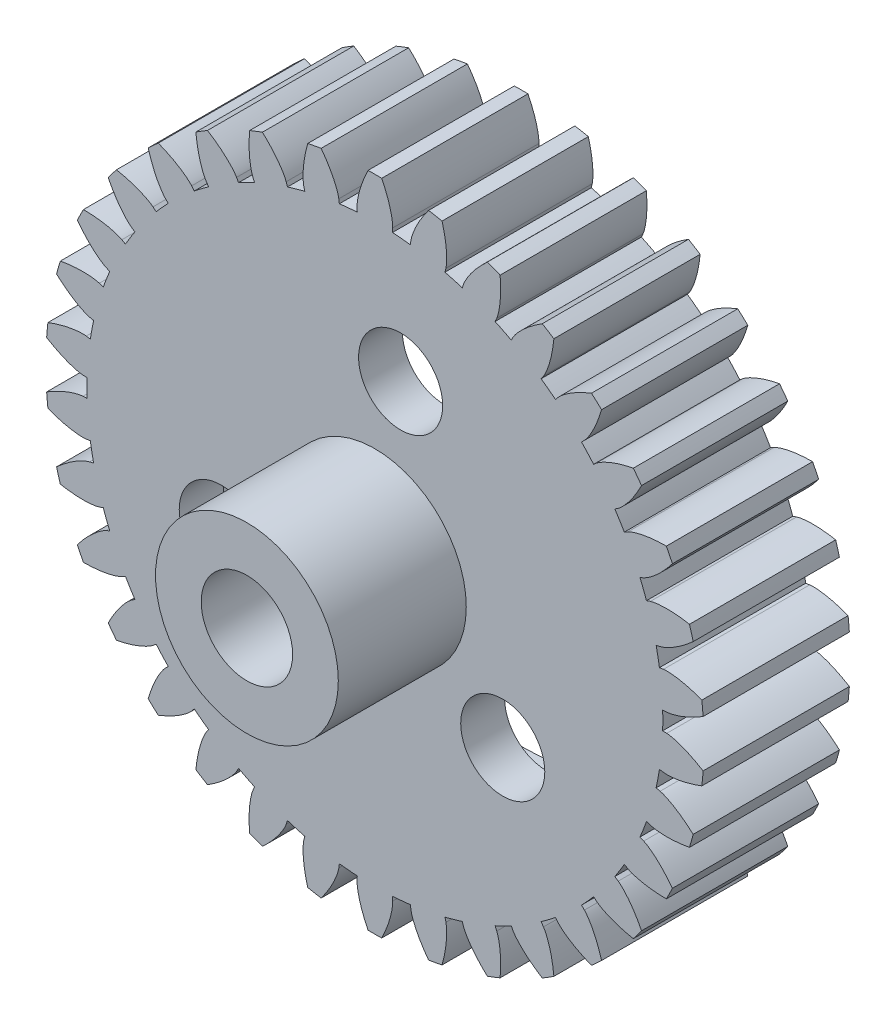
from build123d import *

# Parameters (mm, degrees)
SZKIC1_R                    = 18
DODANIE_WYCI_GNI_CIE1_DEPTH = 8
SZKIC2_R                    = 5
DODANIE_WYCI_GNI_CIE2_DEPTH = 7
SZKIC3_R                    = 2.5
WYTNIJ_WYCI_GNI_CIE1_DEPTH  = 30.546573405
WYTNIJ_WYCI_GNI_CIE3_DEPTH  = 30.546573405
SZYK_KO_OWY2_COUNT          = 34
SZKIC5_R                    = 2.3
WYTNIJ_WYCI_GNI_CIE4_DEPTH  = 30.518484561
SZKIC6_R                    = 13.1
WYTNIJ_WYCI_GNI_CIE5_DEPTH  = 5.6


with BuildPart() as part:
    # Szkic1 → Dodanie-wyciągnięcie1 (new body)
    with BuildSketch(Plane.XY):
        Circle(SZKIC1_R)
    extrude(amount=DODANIE_WYCI_GNI_CIE1_DEPTH)

    # Szkic2 → Dodanie-wyciągnięcie2 (add)
    with BuildSketch(Plane.XY.offset(8)):
        Circle(SZKIC2_R)
    extrude(amount=DODANIE_WYCI_GNI_CIE2_DEPTH)

    # Szkic3 → Wytnij-wyciągnięcie1 (cut, through all)
    with BuildSketch(Plane.XY.offset(15)):
        Circle(SZKIC3_R)
    extrude(amount=-WYTNIJ_WYCI_GNI_CIE1_DEPTH, mode=Mode.SUBTRACT)

    # Szkic4 → Wytnij-wyciągnięcie3 (cut, through all)
    with BuildSketch(Plane(origin=(0, 0, 0), x_dir=(-1, 0, 0), z_dir=(0, 0, -1))):
        with BuildLine():
            add(Edge.make_bspline(
                [(15.966952274, 0.499857083), (15.973588962, 0.500170319), (15.992186505, 0.50137492), (16.02727088, 0.504939353), (16.084356841, 0.51257942), (16.156811425, 0.524989314), (16.250055561, 0.544090693), (16.35930311, 0.570516104), (16.478642956, 0.603649308), (16.607603741, 0.644089594), (16.735410352, 0.688300579), (16.862041069, 0.735980193), (16.98736125, 0.78669031), (17.138115077, 0.851887366), (17.31737635, 0.935292978), (17.524511841, 1.040318379), (17.71815035, 1.147138444), (17.855509236, 1.228083556), (17.933604649, 1.275621993), (17.953855397, 1.288051396)],
                knots=[0, 0, 0, 0, 0, 0.005376749, 0.015083688, 0.02853182, 0.046610139, 0.064854849, 0.092110525, 0.119476176, 0.146842496, 0.174208854, 0.201574956, 0.228941013, 0.256307345, 0.307035032, 0.361767352, 0.416499661, 0.435734814, 0.435734814, 0.435734814, 0.435734814, 0.435734814], degree=4))
            Line((15.966952274, 0.499857083), (15.742287785, 0.492823797))
            ThreePointArc((15.742287785, 0.492823797), (15.75, 0), (15.742287785, -0.492823797))
            Line((15.742287785, -0.492823797), (15.966952274, -0.499857083))
            add(Edge.make_bspline(
                [(15.966952274, -0.499857083), (15.973588962, -0.500170319), (15.992186505, -0.50137492), (16.02727088, -0.504939353), (16.084356841, -0.51257942), (16.156811425, -0.524989314), (16.250055561, -0.544090693), (16.35930311, -0.570516104), (16.478642956, -0.603649308), (16.607603741, -0.644089594), (16.735410352, -0.688300579), (16.862041069, -0.735980193), (16.98736125, -0.78669031), (17.138115077, -0.851887366), (17.31737635, -0.935292978), (17.524511841, -1.040318379), (17.71815035, -1.147138444), (17.855509236, -1.228083556), (17.933604649, -1.275621993), (17.953855397, -1.288051396)],
                knots=[0, 0, 0, 0, 0, 0.005376749, 0.015083688, 0.02853182, 0.046610139, 0.064854849, 0.092110525, 0.119476176, 0.146842496, 0.174208854, 0.201574956, 0.228941013, 0.256307345, 0.307035032, 0.361767352, 0.416499661, 0.435734814, 0.435734814, 0.435734814, 0.435734814, 0.435734814], degree=4))
            ThreePointArc((17.953855397, -1.288051396), (18, 0), (17.953855397, 1.288051396))
        make_face()
        with BuildLine():
            ThreePointArc((17.411478068, -4.565132145), (17.693515794, -3.307491321), (17.884835713, -2.032892399))
            add(Edge.make_bspline(
                [(15.786933067, -2.442573715), (15.79351431, -2.443485301), (15.812016539, -2.4457185), (15.847158499, -2.448661495), (15.904676322, -2.451641033), (15.978177541, -2.452755935), (16.073343888, -2.451113359), (16.185586946, -2.445212075), (16.308983015, -2.434571666), (16.44317888, -2.418516435), (16.576933087, -2.398542629), (16.710168782, -2.374943184), (16.842673108, -2.348124026), (17.002839993, -2.311738017), (17.194374743, -2.262691716), (17.417281726, -2.197515619), (17.627251306, -2.128095352), (17.777145022, -2.073768113), (17.862645876, -2.041389102), (17.884835713, -2.032892399)],
                knots=[0, 0, 0, 0, 0, 0.005376749, 0.015083688, 0.02853182, 0.046610139, 0.064854849, 0.092110525, 0.119476176, 0.146842496, 0.174208854, 0.201574956, 0.228941013, 0.256307345, 0.307035032, 0.361767352, 0.416499661, 0.435734814, 0.435734814, 0.435734814, 0.435734814, 0.435734814], degree=4))
            Line((15.786933067, -2.442573715), (15.564801555, -2.408205254))
            ThreePointArc((15.564801555, -2.408205254), (15.48182632, -2.894054906), (15.383689285, -3.377070325))
            Line((15.383689285, -3.377070325), (15.603236072, -3.425265848))
            add(Edge.make_bspline(
                [(15.603236072, -3.425265848), (15.6097022, -3.426793239), (15.62776174, -3.431394618), (15.661593774, -3.441345097), (15.716303879, -3.459344595), (15.785244474, -3.484856683), (15.873391083, -3.520766389), (15.975922828, -3.566816041), (16.087142476, -3.621313729), (16.206476576, -3.684761925), (16.323983288, -3.751704536), (16.439696771, -3.821840647), (16.553565178, -3.894714851), (16.689772207, -3.986502747), (16.850655475, -4.101427392), (17.034965725, -4.242725582), (17.205679034, -4.383307815), (17.325825499, -4.488114312), (17.393856024, -4.549193312), (17.411478068, -4.565132145)],
                knots=[0, 0, 0, 0, 0, 0.005376749, 0.015083688, 0.02853182, 0.046610139, 0.064854849, 0.092110525, 0.119476176, 0.146842496, 0.174208854, 0.201574956, 0.228941013, 0.256307345, 0.307035032, 0.361767352, 0.416499661, 0.435734814, 0.435734814, 0.435734814, 0.435734814, 0.435734814], degree=4))
        make_face()
    wytnij_wyci_gni_cie3 = extrude(amount=-WYTNIJ_WYCI_GNI_CIE3_DEPTH, mode=Mode.SUBTRACT)

    # Szyk kołowy2: Wytnij-wyciągnięcie3 ×34 about axis
    szyk_ko_owy2_axis = Axis((0, 0, 0), (0, 0, 1))
    for i in range(1, SZYK_KO_OWY2_COUNT):
        add(wytnij_wyci_gni_cie3.rotate(szyk_ko_owy2_axis, i * 360 / SZYK_KO_OWY2_COUNT), mode=Mode.SUBTRACT)

    # Szkic5 → Wytnij-wyciągnięcie4 (cut, through all)
    with BuildSketch(Plane(origin=(0, 0, 0), x_dir=(-1, 0, 0), z_dir=(0, 0, -1))):
        with Locations((-1.407910185, 8.889195065)):
            Circle(SZKIC5_R)
        with Locations((8.402223838, -3.225311546)):
            Circle(SZKIC5_R)
        with Locations((-6.994313653, -5.663883519)):
            Circle(SZKIC5_R)
    extrude(amount=-WYTNIJ_WYCI_GNI_CIE4_DEPTH, mode=Mode.SUBTRACT)

    # Szkic6 → Wytnij-wyciągnięcie5 (cut)
    with BuildSketch(Plane(origin=(0, 0, 0), x_dir=(-1, 0, 0), z_dir=(0, 0, -1))):
        Circle(SZKIC6_R)
    extrude(amount=-WYTNIJ_WYCI_GNI_CIE5_DEPTH, mode=Mode.SUBTRACT)


solid = part.part
